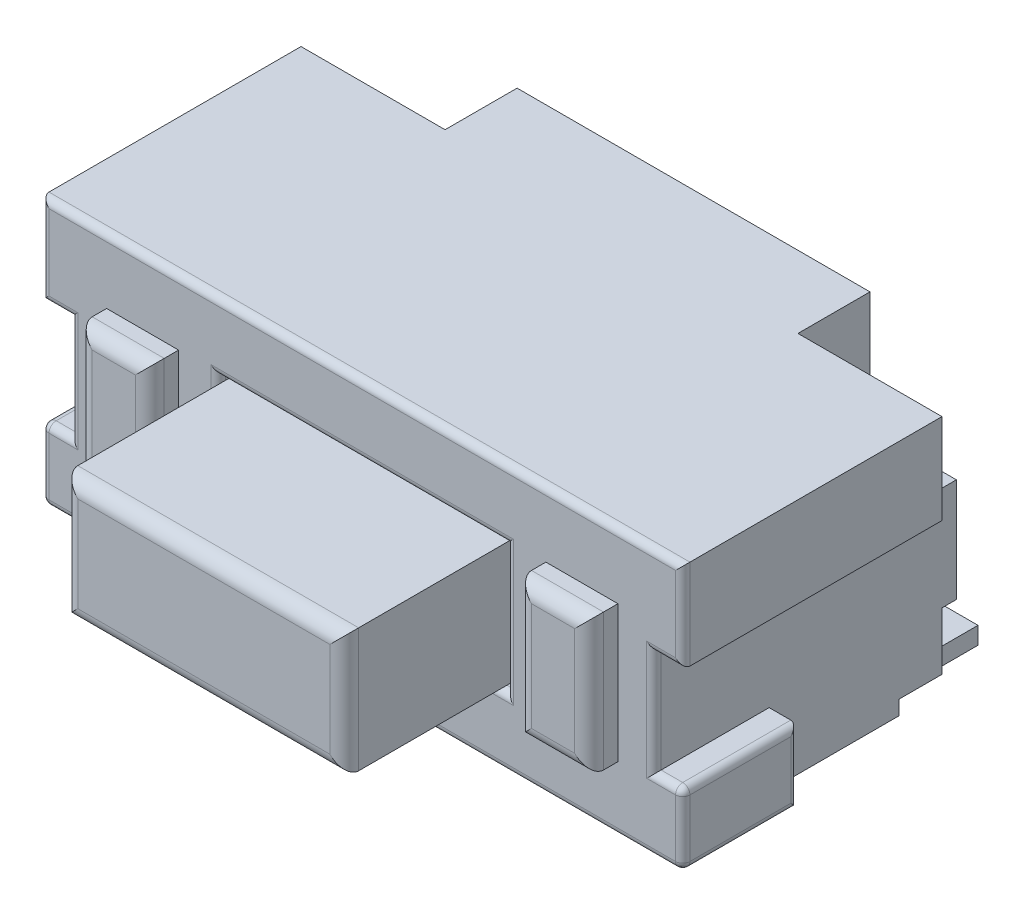
from build123d import *

# Parameters (mm, degrees)
SKETCH_1_W           = 4.45
SKETCH_1_H           = 2.1
EXTRUDE_1_DEPTH      = 1.85
SKETCH_2_W           = 4.45
SKETCH_2_H           = 1.85
EXTRUDE_2_DEPTH      = 0.2
SKETCH_3_W           = 0.2
SKETCH_3_H           = 0.6
CUT_EXTRUDE_1_DEPTH  = 6.33994382
SKETCH_4_W           = 2
SKETCH_4_H           = 0.9
CUT_EXTRUDE_2_DEPTH  = 0.5
SKETCH_5_W           = 1.95
SKETCH_5_H           = 0.86
EXTRUDE_3_DEPTH      = 1.6
SKETCH_6_W           = 0.5
SKETCH_6_H           = 0.95
EXTRUDE_4_DEPTH      = 0.2
EXTRUDE_4_2_DEPTH    = 0.2
SKETCH_7_R           = 0.25
EXTRUDE_5_DEPTH      = 0.4
SKETCH_8_W           = 1
SKETCH_8_H           = 0.5
CUT_EXTRUDE_3_DEPTH  = 0.63
SKETCH_11_W          = 2.3
SKETCH_11_H          = 0.625
CUT_EXTRUDE_5_DEPTH  = 0.2
SKETCH_12_W          = 2.3
SKETCH_12_H          = 0.625
CUT_EXTRUDE_6_DEPTH  = 0.2
SKETCH_14_W          = 0.8
SKETCH_14_H          = 0.5
EXTRUDE_6_DEPTH      = 0.2
SKETCH_15_W          = 0.8
SKETCH_15_H          = 0.5
EXTRUDE_7_DEPTH      = 0.2
SKETCH_16_W          = 0.7
SKETCH_16_H          = 0.6
CUT_EXTRUDE_7_DEPTH  = 0.1
SKETCH_17_W          = 0.36
SKETCH_17_H          = 0.72
EXTRUDE_8_DEPTH      = 0.12
FILLET_1_R           = 0.25
FILLET_2_R           = 0.1
FILLET_3_R           = 0.1
FILLET_4_R           = 0.1
FILLET_5_R           = 0.05
FILLET_6_R           = 0.05
SKETCH_18_W          = 4.05
SKETCH_18_H          = 0.72
CUT_EXTRUDE_8_DEPTH  = 0.2
SKETCH_19_W          = 1.5
SKETCH_19_H          = 1.22
CUT_EXTRUDE_9_DEPTH  = 0.2
SKETCH_20_W          = 0.7
SKETCH_20_H          = 0.4
CUT_EXTRUDE_10_DEPTH = 0.3


with BuildPart() as part:
    # 草图1 → 凸台-拉伸1 (new body)
    with BuildSketch(Plane(origin=(0, 0, 0), x_dir=(1, 0, 0), z_dir=(0, 1, 0))):
        with Locations((2.225, 1.05)):
            Rectangle(SKETCH_1_W, SKETCH_1_H)
    extrude(amount=EXTRUDE_1_DEPTH)


with BuildPart() as body_2:
    # 草图2 → 凸台-拉伸2 (new body)
    with BuildSketch(Plane.XY):
        with Locations((2.225, 0.925)):
            Rectangle(SKETCH_2_W, SKETCH_2_H)
    extrude(amount=EXTRUDE_2_DEPTH)


with BuildPart() as cut_extrude_1_tool:
    # 草图3 → 切除-拉伸1 (new, through all)
    with BuildSketch(Plane.XY.offset(0.2)):
        with Locations((4.35, 0.925)):
            Rectangle(SKETCH_3_W, SKETCH_3_H)
        with Locations((0.1, 0.925)):
            Rectangle(SKETCH_3_W, SKETCH_3_H)
    extrude(amount=-CUT_EXTRUDE_1_DEPTH)


with BuildPart() as part_1:
    add(part.part)

    # 切除-拉伸1: cut by cut_extrude_1_tool
    add(cut_extrude_1_tool.part, mode=Mode.SUBTRACT)


with BuildPart() as body_2_1:
    add(body_2.part)

    # 切除-拉伸1: cut by cut_extrude_1_tool
    add(cut_extrude_1_tool.part, mode=Mode.SUBTRACT)


with BuildPart() as cut_extrude_2_tool:
    # 草图4 → 切除-拉伸2 (new body)
    with BuildSketch(Plane.XY.offset(0.2)):
        with Locations((2.225, 0.925)):
            Rectangle(SKETCH_4_W, SKETCH_4_H)
    extrude(amount=-CUT_EXTRUDE_2_DEPTH)


with BuildPart() as part_2:
    add(part_1.part)

    # 切除-拉伸2: cut by cut_extrude_2_tool
    add(cut_extrude_2_tool.part, mode=Mode.SUBTRACT)



with BuildPart() as body_2_2:
    add(body_2_1.part)

    # 切除-拉伸2: cut by cut_extrude_2_tool
    add(cut_extrude_2_tool.part, mode=Mode.SUBTRACT)


with BuildPart() as part_3:
    add(part_2.part)

    add(body_2_2.part)  # 凸台-拉伸3 merges body 2
    # 草图5 → 凸台-拉伸3 (add)
    with BuildSketch(Plane.XY.offset(-0.3)):
        with Locations((2.225, 0.925)):
            Rectangle(SKETCH_5_W, SKETCH_5_H)
    extrude(amount=EXTRUDE_3_DEPTH)

    # 草图7 → 凸台-拉伸5 (add)
    with BuildSketch(Plane.XZ):
        with Locations(Location((1.375, -0.7, 0), (0, 0, 270))):
            Circle(SKETCH_7_R)
        with Locations(Location((3.075, -0.7, 0), (0, 0, 90))):
            Circle(SKETCH_7_R)
    extrude(amount=EXTRUDE_5_DEPTH)

    # 草图8 → 切除-拉伸3 (cut)
    with BuildSketch(Plane(origin=(0, 1.85, 0), x_dir=(1, 0, 0), z_dir=(0, 1, 0))):
        with Locations((3.95, 1.85)):
            Rectangle(SKETCH_8_W, SKETCH_8_H)
        with Locations((0.5, 1.85)):
            Rectangle(SKETCH_8_W, SKETCH_8_H)
    extrude(amount=-CUT_EXTRUDE_3_DEPTH, mode=Mode.SUBTRACT)

    # 草图11 → 切除-拉伸5 (cut)
    with BuildSketch(Plane(origin=(4.45, 0, 0), x_dir=(0, 0, -1), z_dir=(1, 0, 0))):
        with Locations((0.95, 0.3125)):
            Rectangle(SKETCH_11_W, SKETCH_11_H)
    extrude(amount=-CUT_EXTRUDE_5_DEPTH, mode=Mode.SUBTRACT)

    # 草图12 → 切除-拉伸6 (cut)
    with BuildSketch(Plane.ZY):
        with Locations((-0.95, 0.3125)):
            Rectangle(SKETCH_12_W, SKETCH_12_H)
    extrude(amount=-CUT_EXTRUDE_6_DEPTH, mode=Mode.SUBTRACT)

    # 草图14 → 凸台-拉伸6 (add)
    with BuildSketch(Plane(origin=(4.25, 0, 0), x_dir=(0, 0, -1), z_dir=(1, 0, 0))):
        with Locations((0.2, 0.25)):
            Rectangle(SKETCH_14_W, SKETCH_14_H)
    extrude(amount=EXTRUDE_6_DEPTH)

    # 草图15 → 凸台-拉伸7 (add)
    with BuildSketch(Plane.ZY.offset(-0.2)):
        with Locations((-0.2, 0.25)):
            Rectangle(SKETCH_15_W, SKETCH_15_H)
    extrude(amount=EXTRUDE_7_DEPTH)

    # 草图16 → 切除-拉伸7 (cut)
    with BuildSketch(Plane.XZ):
        with Locations((0.55, -1.8)):
            Rectangle(SKETCH_16_W, SKETCH_16_H)
        with Locations((3.9, -1.8)):
            Rectangle(SKETCH_16_W, SKETCH_16_H)
    extrude(amount=-CUT_EXTRUDE_7_DEPTH, mode=Mode.SUBTRACT)

    # 草图17 → 凸台-拉伸8 (add)
    with BuildSketch(Plane.XZ.offset(-0.1)):
        with Locations((3.9, -1.86)):
            Rectangle(SKETCH_17_W, SKETCH_17_H)
        with Locations((0.55, -1.86)):
            Rectangle(SKETCH_17_W, SKETCH_17_H)
    extrude(amount=EXTRUDE_8_DEPTH)

    # 圆角1
    fillet_1_edges = [part_3.edges().sort_by_distance(p)[0] for p in [
        (1.375, -0.4, -0.45),
        (3.075, -0.4, -0.95),
    ]]
    fillet(fillet_1_edges, radius=FILLET_1_R)

    # 圆角4
    fillet_4_edges = [part_3.edges().sort_by_distance(p)[0] for p in [
        (3.2, 0.925, 1.3),
        (2.225, 1.355, 1.3),
        (1.25, 0.925, 1.3),
        (2.225, 0.495, 1.3),
    ]]
    fillet(fillet_4_edges, radius=FILLET_4_R)

    # 圆角5
    fillet_5_edges = [part_3.edges().sort_by_distance(p)[0] for p in [
        (4.45, 0.25, 0.2),
        (4.45, 0, -0.2),
        (4.45, 0.25, -0.6),
        (4.45, 0.5, -0.2),
        (0, 0.25, 0.2),
        (0, 0.5, -0.2),
        (0, 0.25, -0.6),
        (0, 0, -0.2),
    ]]
    fillet(fillet_5_edges, radius=FILLET_5_R)

    # 圆角6
    # the kernel refuses this fillet: 0.05 mm, written as the material it takes off along each edge
    with BuildSketch(Plane(origin=(0.05, 0.45, 0.15), x_dir=(0, 1, 0), z_dir=(0, 0, 1))) as fillet_6_piece_1_section:
        Polygon((0, 0), (FILLET_6_R, 0), (FILLET_6_R, FILLET_6_R), (0, FILLET_6_R), align=None)
    fillet_6_piece_1 = extrude(amount=FILLET_6_R, mode=Mode.PRIVATE)
    fillet_6_piece_1 = fillet_6_piece_1 - Plane(origin=(0.05, 0.45, 0.15), x_dir=(0.7071067811865475, -0.7071067811865475, 0), z_dir=(0, 0, 1)) * Sphere(FILLET_6_R, mode=Mode.PRIVATE)
    add(fillet_6_piece_1, mode=Mode.SUBTRACT)
    with BuildSketch(Plane(origin=(0.05, 0.05, 0.15), x_dir=(0, -1, 0), z_dir=(0, 0, 1))) as fillet_6_piece_2_section:
        Polygon((0, 0), (FILLET_6_R, 0), (FILLET_6_R, -FILLET_6_R), (0, -FILLET_6_R), align=None)
    fillet_6_piece_2 = extrude(amount=FILLET_6_R, mode=Mode.PRIVATE)
    fillet_6_piece_2 = fillet_6_piece_2 - Plane(origin=(0.05, 0.05, 0.15), x_dir=(0.7071067811865475, 0.7071067811865475, 0), z_dir=(0, 0, 1)) * Sphere(FILLET_6_R, mode=Mode.PRIVATE)
    add(fillet_6_piece_2, mode=Mode.SUBTRACT)
    with BuildSketch(Plane(origin=(4.4, 0.05, 0.15), x_dir=(0, -1, 0), z_dir=(0, 0, 1))) as fillet_6_piece_3_section:
        Polygon((0, 0), (FILLET_6_R, 0), (FILLET_6_R, FILLET_6_R), (0, FILLET_6_R), align=None)
    fillet_6_piece_3 = extrude(amount=FILLET_6_R, mode=Mode.PRIVATE)
    fillet_6_piece_3 = fillet_6_piece_3 - Plane(origin=(4.4, 0.05, 0.15), x_dir=(-0.7071067811865475, 0.7071067811865475, 0), z_dir=(0, 0, 1)) * Sphere(FILLET_6_R, mode=Mode.PRIVATE)
    add(fillet_6_piece_3, mode=Mode.SUBTRACT)
    with BuildSketch(Plane(origin=(4.4, 0.45, 0.15), x_dir=(0, 1, 0), z_dir=(0, 0, 1))) as fillet_6_piece_4_section:
        Polygon((0, 0), (FILLET_6_R, 0), (FILLET_6_R, -FILLET_6_R), (0, -FILLET_6_R), align=None)
    fillet_6_piece_4 = extrude(amount=FILLET_6_R, mode=Mode.PRIVATE)
    fillet_6_piece_4 = fillet_6_piece_4 - Plane(origin=(4.4, 0.45, 0.15), x_dir=(-0.7071067811865475, -0.7071067811865475, 0), z_dir=(0, 0, 1)) * Sphere(FILLET_6_R, mode=Mode.PRIVATE)
    add(fillet_6_piece_4, mode=Mode.SUBTRACT)
    with BuildSketch(Plane(origin=(0.2, 1.225, 0.2), x_dir=(1, 0, 0), z_dir=(0, -1, 0))) as fillet_6_piece_5:
        with BuildLine():
            CenterArc((FILLET_6_R, -FILLET_6_R), FILLET_6_R, 90, 90)
            Line((0, -FILLET_6_R), (0, 0))
            Line((0, 0), (FILLET_6_R, 0))
        make_face()
    extrude(amount=0.725, mode=Mode.SUBTRACT)
    with BuildSketch(Plane(origin=(4.4, 0, 0.2), x_dir=(0, 1, 0), z_dir=(-1, 0, 0))) as fillet_6_piece_6:
        with BuildLine():
            CenterArc((FILLET_6_R, FILLET_6_R), FILLET_6_R, 180, 90)
            Line((0, FILLET_6_R), (0, 0))
            Line((0, 0), (FILLET_6_R, 0))
        make_face()
    extrude(amount=4.35, mode=Mode.SUBTRACT)
    with BuildSketch(Plane(origin=(0.2, 0.5, 0.2), x_dir=(0, -1, 0), z_dir=(-1, 0, 0))) as fillet_6_piece_7:
        with BuildLine():
            CenterArc((FILLET_6_R, -FILLET_6_R), FILLET_6_R, 90, 90)
            Line((0, -FILLET_6_R), (0, 0))
            Line((0, 0), (FILLET_6_R, 0))
        make_face()
    extrude(amount=0.15, mode=Mode.SUBTRACT)
    with BuildSketch(Plane(origin=(4.25, 0.5, 0.2), x_dir=(0, -1, 0), z_dir=(1, 0, 0))) as fillet_6_piece_8:
        with BuildLine():
            CenterArc((FILLET_6_R, FILLET_6_R), FILLET_6_R, 180, 90)
            Line((0, FILLET_6_R), (0, 0))
            Line((0, 0), (FILLET_6_R, 0))
        make_face()
    extrude(amount=0.15, mode=Mode.SUBTRACT)
    with BuildSketch(Plane(origin=(0, 1.975, 0.2), x_dir=(1, 0, 0), z_dir=(0, -1, 0)), Plane(origin=(4.45, 1.1, 0.2), x_dir=(-1, 0, 0), z_dir=(0, 1, 0))) as fillet_6_piece_9:
        with BuildLine():
            CenterArc((FILLET_6_R, -FILLET_6_R), FILLET_6_R, 90, 90)
            Line((0, -FILLET_6_R), (0, 0))
            Line((0, 0), (FILLET_6_R, 0))
        make_face()
    extrude(amount=0.875, mode=Mode.SUBTRACT)
    with BuildSketch(Plane(origin=(4.575, 1.85, 0.2), x_dir=(0, -1, 0), z_dir=(-1, 0, 0))) as fillet_6_piece_10:
        with BuildLine():
            CenterArc((FILLET_6_R, -FILLET_6_R), FILLET_6_R, 90, 90)
            Line((0, -FILLET_6_R), (0, 0))
            Line((0, 0), (FILLET_6_R, 0))
        make_face()
    extrude(amount=4.7, mode=Mode.SUBTRACT)
    with BuildSketch(Plane(origin=(4.25, 1.225, 0.2), x_dir=(-1, 0, 0), z_dir=(0, -1, 0))) as fillet_6_piece_11:
        with BuildLine():
            CenterArc((FILLET_6_R, FILLET_6_R), FILLET_6_R, 180, 90)
            Line((0, FILLET_6_R), (0, 0))
            Line((0, 0), (FILLET_6_R, 0))
        make_face()
    extrude(amount=0.725, mode=Mode.SUBTRACT)
    with BuildSketch(Plane(origin=(4.25, 1.225, 0.2), x_dir=(0, 1, 0), z_dir=(1, 0, 0))) as fillet_6_piece_12:
        with BuildLine():
            CenterArc((FILLET_6_R, -FILLET_6_R), FILLET_6_R, 90, 90)
            Line((0, -FILLET_6_R), (0, 0))
            Line((0, 0), (FILLET_6_R, 0))
        make_face()
    extrude(amount=0.325, mode=Mode.SUBTRACT)
    with BuildSketch(Plane(origin=(0.2, 1.225, 0.2), x_dir=(0, 1, 0), z_dir=(-1, 0, 0))) as fillet_6_piece_13:
        with BuildLine():
            CenterArc((FILLET_6_R, FILLET_6_R), FILLET_6_R, 180, 90)
            Line((0, FILLET_6_R), (0, 0))
            Line((0, 0), (FILLET_6_R, 0))
        make_face()
    extrude(amount=0.325, mode=Mode.SUBTRACT)
    with BuildSketch(Plane(origin=(3.225, 1.375, 0.2), x_dir=(1, 0, 0), z_dir=(0, -1, 0)), Plane(origin=(1.225, 0.475, 0.2), x_dir=(-1, 0, 0), z_dir=(0, 1, 0))) as fillet_6_piece_14:
        with BuildLine():
            CenterArc((FILLET_6_R, -FILLET_6_R), FILLET_6_R, 90, 90)
            Line((0, -FILLET_6_R), (0, 0))
            Line((0, 0), (FILLET_6_R, 0))
        make_face()
    extrude(amount=0.9, mode=Mode.SUBTRACT)
    with BuildSketch(Plane(origin=(3.225, 0.475, 0.2), x_dir=(0, -1, 0), z_dir=(-1, 0, 0)), Plane(origin=(1.225, 1.375, 0.2), x_dir=(0, 1, 0), z_dir=(1, 0, 0))) as fillet_6_piece_15:
        with BuildLine():
            CenterArc((FILLET_6_R, -FILLET_6_R), FILLET_6_R, 90, 90)
            Line((0, -FILLET_6_R), (0, 0))
            Line((0, 0), (FILLET_6_R, 0))
        make_face()
    extrude(amount=2, mode=Mode.SUBTRACT)
    with BuildSketch(Plane(origin=(0.2, 1.35, 0.2), x_dir=(1, 0, 0), z_dir=(0, -1, 0))) as fillet_6_piece_16a_section:
        with BuildLine():
            CenterArc((FILLET_6_R, -FILLET_6_R), FILLET_6_R, 90, 90)
            Line((0, -FILLET_6_R), (0, 0))
            Line((0, 0), (FILLET_6_R, 0))
        make_face()
    fillet_6_piece_16a = extrude(amount=0.85, mode=Mode.PRIVATE)
    fillet_6_piece_16a = split(fillet_6_piece_16a, bisect_by=Plane(origin=(0.211319756, 1.225, 0.188680244), z_dir=(0, 1, 0)), keep=Keep.TOP, mode=Mode.PRIVATE)
    with BuildSketch(Plane(origin=(0.325, 1.225, 0.2), x_dir=(0, 1, 0), z_dir=(-1, 0, 0))) as fillet_6_piece_16b_section:
        with BuildLine():
            CenterArc((FILLET_6_R, FILLET_6_R), FILLET_6_R, 180, 90)
            Line((0, FILLET_6_R), (0, 0))
            Line((0, 0), (FILLET_6_R, 0))
        make_face()
    fillet_6_piece_16b = extrude(amount=0.45, mode=Mode.PRIVATE)
    fillet_6_piece_16b = split(fillet_6_piece_16b, bisect_by=Plane(origin=(0.2, 1.236319756, 0.188680244), z_dir=(1, 0, 0)), keep=Keep.TOP, mode=Mode.PRIVATE)
    fillet_6_piece_16 = fillet_6_piece_16a & fillet_6_piece_16b
    add(fillet_6_piece_16, mode=Mode.SUBTRACT)
    with BuildSketch(Plane(origin=(0.325, 0.5, 0.2), x_dir=(0, -1, 0), z_dir=(-1, 0, 0))) as fillet_6_piece_17a_section:
        with BuildLine():
            CenterArc((FILLET_6_R, -FILLET_6_R), FILLET_6_R, 90, 90)
            Line((0, -FILLET_6_R), (0, 0))
            Line((0, 0), (FILLET_6_R, 0))
        make_face()
    fillet_6_piece_17a = extrude(amount=0.275, mode=Mode.PRIVATE)
    fillet_6_piece_17a = split(fillet_6_piece_17a, bisect_by=Plane(origin=(0.2, 0.488680244, 0.188680244), z_dir=(1, 0, 0)), keep=Keep.TOP, mode=Mode.PRIVATE)
    with BuildSketch(Plane(origin=(0.2, 1.225, 0.2), x_dir=(1, 0, 0), z_dir=(0, -1, 0))) as fillet_6_piece_17b_section:
        with BuildLine():
            CenterArc((FILLET_6_R, -FILLET_6_R), FILLET_6_R, 90, 90)
            Line((0, -FILLET_6_R), (0, 0))
            Line((0, 0), (FILLET_6_R, 0))
        make_face()
    fillet_6_piece_17b = extrude(amount=0.85, mode=Mode.PRIVATE)
    fillet_6_piece_17b = split(fillet_6_piece_17b, bisect_by=Plane(origin=(0.211319756, 0.5, 0.188680244), z_dir=(0, -1, 0)), keep=Keep.TOP, mode=Mode.PRIVATE)
    fillet_6_piece_17 = fillet_6_piece_17a & fillet_6_piece_17b
    add(fillet_6_piece_17, mode=Mode.SUBTRACT)
    with BuildSketch(Plane(origin=(4.125, 0.5, 0.2), x_dir=(0, -1, 0), z_dir=(1, 0, 0))) as fillet_6_piece_18a_section:
        with BuildLine():
            CenterArc((FILLET_6_R, FILLET_6_R), FILLET_6_R, 180, 90)
            Line((0, FILLET_6_R), (0, 0))
            Line((0, 0), (FILLET_6_R, 0))
        make_face()
    fillet_6_piece_18a = extrude(amount=0.275, mode=Mode.PRIVATE)
    fillet_6_piece_18a = split(fillet_6_piece_18a, bisect_by=Plane(origin=(4.25, 0.488680244, 0.188680244), z_dir=(-1, 0, 0)), keep=Keep.TOP, mode=Mode.PRIVATE)
    with BuildSketch(Plane(origin=(4.25, 1.225, 0.2), x_dir=(-1, 0, 0), z_dir=(0, -1, 0))) as fillet_6_piece_18b_section:
        with BuildLine():
            CenterArc((FILLET_6_R, FILLET_6_R), FILLET_6_R, 180, 90)
            Line((0, FILLET_6_R), (0, 0))
            Line((0, 0), (FILLET_6_R, 0))
        make_face()
    fillet_6_piece_18b = extrude(amount=0.85, mode=Mode.PRIVATE)
    fillet_6_piece_18b = split(fillet_6_piece_18b, bisect_by=Plane(origin=(4.238680244, 0.5, 0.188680244), z_dir=(0, -1, 0)), keep=Keep.TOP, mode=Mode.PRIVATE)
    fillet_6_piece_18 = fillet_6_piece_18a & fillet_6_piece_18b
    add(fillet_6_piece_18, mode=Mode.SUBTRACT)
    with BuildSketch(Plane(origin=(4.25, 1.35, 0.2), x_dir=(-1, 0, 0), z_dir=(0, -1, 0))) as fillet_6_piece_19a_section:
        with BuildLine():
            CenterArc((FILLET_6_R, FILLET_6_R), FILLET_6_R, 180, 90)
            Line((0, FILLET_6_R), (0, 0))
            Line((0, 0), (FILLET_6_R, 0))
        make_face()
    fillet_6_piece_19a = extrude(amount=0.85, mode=Mode.PRIVATE)
    fillet_6_piece_19a = split(fillet_6_piece_19a, bisect_by=Plane(origin=(4.238680244, 1.225, 0.188680244), z_dir=(0, 1, 0)), keep=Keep.TOP, mode=Mode.PRIVATE)
    with BuildSketch(Plane(origin=(4.125, 1.225, 0.2), x_dir=(0, 1, 0), z_dir=(1, 0, 0))) as fillet_6_piece_19b_section:
        with BuildLine():
            CenterArc((FILLET_6_R, -FILLET_6_R), FILLET_6_R, 90, 90)
            Line((0, -FILLET_6_R), (0, 0))
            Line((0, 0), (FILLET_6_R, 0))
        make_face()
    fillet_6_piece_19b = extrude(amount=0.45, mode=Mode.PRIVATE)
    fillet_6_piece_19b = split(fillet_6_piece_19b, bisect_by=Plane(origin=(4.25, 1.236319756, 0.188680244), z_dir=(-1, 0, 0)), keep=Keep.TOP, mode=Mode.PRIVATE)
    fillet_6_piece_19 = fillet_6_piece_19a & fillet_6_piece_19b
    add(fillet_6_piece_19, mode=Mode.SUBTRACT)
    with BuildSketch(Plane(origin=(1.225, 1.375, 0.2), x_dir=(0, 1, 0), z_dir=(1, 0, 0))) as fillet_6_piece_20a_section:
        with BuildLine():
            CenterArc((FILLET_6_R, -FILLET_6_R), FILLET_6_R, 90, 90)
            Line((0, -FILLET_6_R), (0, 0))
            Line((0, 0), (FILLET_6_R, 0))
        make_face()
    fillet_6_piece_20a = extrude(amount=2.125, mode=Mode.PRIVATE)
    fillet_6_piece_20a = split(fillet_6_piece_20a, bisect_by=Plane(origin=(3.225, 1.386319756, 0.188680244), z_dir=(1, 0, 0)), keep=Keep.TOP, mode=Mode.PRIVATE)
    with BuildSketch(Plane(origin=(3.225, 1.5, 0.2), x_dir=(1, 0, 0), z_dir=(0, -1, 0))) as fillet_6_piece_20b_section:
        with BuildLine():
            CenterArc((FILLET_6_R, -FILLET_6_R), FILLET_6_R, 90, 90)
            Line((0, -FILLET_6_R), (0, 0))
            Line((0, 0), (FILLET_6_R, 0))
        make_face()
    fillet_6_piece_20b = extrude(amount=1.025, mode=Mode.PRIVATE)
    fillet_6_piece_20b = split(fillet_6_piece_20b, bisect_by=Plane(origin=(3.236319756, 1.375, 0.188680244), z_dir=(0, 1, 0)), keep=Keep.TOP, mode=Mode.PRIVATE)
    fillet_6_piece_20 = fillet_6_piece_20a & fillet_6_piece_20b
    add(fillet_6_piece_20, mode=Mode.SUBTRACT)
    with BuildSketch(Plane(origin=(3.225, 1.375, 0.2), x_dir=(1, 0, 0), z_dir=(0, -1, 0))) as fillet_6_piece_21a_section:
        with BuildLine():
            CenterArc((FILLET_6_R, -FILLET_6_R), FILLET_6_R, 90, 90)
            Line((0, -FILLET_6_R), (0, 0))
            Line((0, 0), (FILLET_6_R, 0))
        make_face()
    fillet_6_piece_21a = extrude(amount=1.025, mode=Mode.PRIVATE)
    fillet_6_piece_21a = split(fillet_6_piece_21a, bisect_by=Plane(origin=(3.236319756, 0.475, 0.188680244), z_dir=(0, -1, 0)), keep=Keep.TOP, mode=Mode.PRIVATE)
    with BuildSketch(Plane(origin=(3.35, 0.475, 0.2), x_dir=(0, -1, 0), z_dir=(-1, 0, 0))) as fillet_6_piece_21b_section:
        with BuildLine():
            CenterArc((FILLET_6_R, -FILLET_6_R), FILLET_6_R, 90, 90)
            Line((0, -FILLET_6_R), (0, 0))
            Line((0, 0), (FILLET_6_R, 0))
        make_face()
    fillet_6_piece_21b = extrude(amount=2.125, mode=Mode.PRIVATE)
    fillet_6_piece_21b = split(fillet_6_piece_21b, bisect_by=Plane(origin=(3.225, 0.463680244, 0.188680244), z_dir=(1, 0, 0)), keep=Keep.TOP, mode=Mode.PRIVATE)
    fillet_6_piece_21 = fillet_6_piece_21a & fillet_6_piece_21b
    add(fillet_6_piece_21, mode=Mode.SUBTRACT)
    with BuildSketch(Plane(origin=(1.225, 0.35, 0.2), x_dir=(-1, 0, 0), z_dir=(0, 1, 0))) as fillet_6_piece_22a_section:
        with BuildLine():
            CenterArc((FILLET_6_R, -FILLET_6_R), FILLET_6_R, 90, 90)
            Line((0, -FILLET_6_R), (0, 0))
            Line((0, 0), (FILLET_6_R, 0))
        make_face()
    fillet_6_piece_22a = extrude(amount=1.025, mode=Mode.PRIVATE)
    fillet_6_piece_22a = split(fillet_6_piece_22a, bisect_by=Plane(origin=(1.213680244, 0.475, 0.188680244), z_dir=(0, -1, 0)), keep=Keep.TOP, mode=Mode.PRIVATE)
    with BuildSketch(Plane(origin=(3.225, 0.475, 0.2), x_dir=(0, -1, 0), z_dir=(-1, 0, 0))) as fillet_6_piece_22b_section:
        with BuildLine():
            CenterArc((FILLET_6_R, -FILLET_6_R), FILLET_6_R, 90, 90)
            Line((0, -FILLET_6_R), (0, 0))
            Line((0, 0), (FILLET_6_R, 0))
        make_face()
    fillet_6_piece_22b = extrude(amount=2.125, mode=Mode.PRIVATE)
    fillet_6_piece_22b = split(fillet_6_piece_22b, bisect_by=Plane(origin=(1.225, 0.463680244, 0.188680244), z_dir=(-1, 0, 0)), keep=Keep.TOP, mode=Mode.PRIVATE)
    fillet_6_piece_22 = fillet_6_piece_22a & fillet_6_piece_22b
    add(fillet_6_piece_22, mode=Mode.SUBTRACT)
    with BuildSketch(Plane(origin=(1.225, 0.475, 0.2), x_dir=(-1, 0, 0), z_dir=(0, 1, 0))) as fillet_6_piece_23a_section:
        with BuildLine():
            CenterArc((FILLET_6_R, -FILLET_6_R), FILLET_6_R, 90, 90)
            Line((0, -FILLET_6_R), (0, 0))
            Line((0, 0), (FILLET_6_R, 0))
        make_face()
    fillet_6_piece_23a = extrude(amount=1.025, mode=Mode.PRIVATE)
    fillet_6_piece_23a = split(fillet_6_piece_23a, bisect_by=Plane(origin=(1.213680244, 1.375, 0.188680244), z_dir=(0, 1, 0)), keep=Keep.TOP, mode=Mode.PRIVATE)
    with BuildSketch(Plane(origin=(1.1, 1.375, 0.2), x_dir=(0, 1, 0), z_dir=(1, 0, 0))) as fillet_6_piece_23b_section:
        with BuildLine():
            CenterArc((FILLET_6_R, -FILLET_6_R), FILLET_6_R, 90, 90)
            Line((0, -FILLET_6_R), (0, 0))
            Line((0, 0), (FILLET_6_R, 0))
        make_face()
    fillet_6_piece_23b = extrude(amount=2.125, mode=Mode.PRIVATE)
    fillet_6_piece_23b = split(fillet_6_piece_23b, bisect_by=Plane(origin=(1.225, 1.386319756, 0.188680244), z_dir=(-1, 0, 0)), keep=Keep.TOP, mode=Mode.PRIVATE)
    fillet_6_piece_23 = fillet_6_piece_23a & fillet_6_piece_23b
    add(fillet_6_piece_23, mode=Mode.SUBTRACT)

    # 草图18 → 切除-拉伸8 (cut)
    with BuildSketch(Plane(origin=(0, 0, -2.1), x_dir=(-1, 0, 0), z_dir=(0, 0, -1))):
        with Locations((-2.225, 0.86)):
            Rectangle(SKETCH_18_W, SKETCH_18_H)
    extrude(amount=-CUT_EXTRUDE_8_DEPTH, mode=Mode.SUBTRACT)

    # 草图19 → 切除-拉伸9 (cut)
    with BuildSketch(Plane(origin=(0, 0, -2.1), x_dir=(-1, 0, 0), z_dir=(0, 0, -1))):
        with Locations((-2.225, 0.61)):
            Rectangle(SKETCH_19_W, SKETCH_19_H)
    extrude(amount=-CUT_EXTRUDE_9_DEPTH, mode=Mode.SUBTRACT)

    # 草图20 → 切除-拉伸10 (cut)
    with BuildSketch(Plane(origin=(0, 0, -2.1), x_dir=(-1, 0, 0), z_dir=(0, 0, -1))):
        with Locations((-3.9, 0.3)):
            Rectangle(SKETCH_20_W, SKETCH_20_H)
        with Locations((-0.55, 0.3)):
            Rectangle(SKETCH_20_W, SKETCH_20_H)
    extrude(amount=-CUT_EXTRUDE_10_DEPTH, mode=Mode.SUBTRACT)


with BuildPart() as body_2_2_1:
    # 草图6 → 凸台-拉伸4 (new body)
    with BuildSketch(Plane.XY.offset(0.2)):
        with Locations((0.7, 0.925)):
            Rectangle(SKETCH_6_W, SKETCH_6_H)
    extrude(amount=EXTRUDE_4_DEPTH)

    # 圆角2
    fillet_2_edges = [body_2_2_1.edges().sort_by_distance(p)[0] for p in [
        (0.45, 0.925, 0.4),
        (0.7, 0.45, 0.4),
        (0.95, 0.925, 0.4),
        (0.7, 1.4, 0.4),
    ]]
    fillet(fillet_2_edges, radius=FILLET_2_R)


with BuildPart() as body_3:
    # 草图6 → Extrude 4 2 (new body)
    with BuildSketch(Plane.XY.offset(0.2)):
        with Locations((3.75, 0.925)):
            Rectangle(SKETCH_6_W, SKETCH_6_H)
    extrude(amount=EXTRUDE_4_2_DEPTH)

    # 圆角3
    fillet_3_edges = [body_3.edges().sort_by_distance(p)[0] for p in [
        (3.5, 0.925, 0.4),
        (3.75, 0.45, 0.4),
        (4, 0.925, 0.4),
        (3.75, 1.4, 0.4),
    ]]
    fillet(fillet_3_edges, radius=FILLET_3_R)


solid = Compound([part_3.part, body_2_2_1.part, body_3.part])
